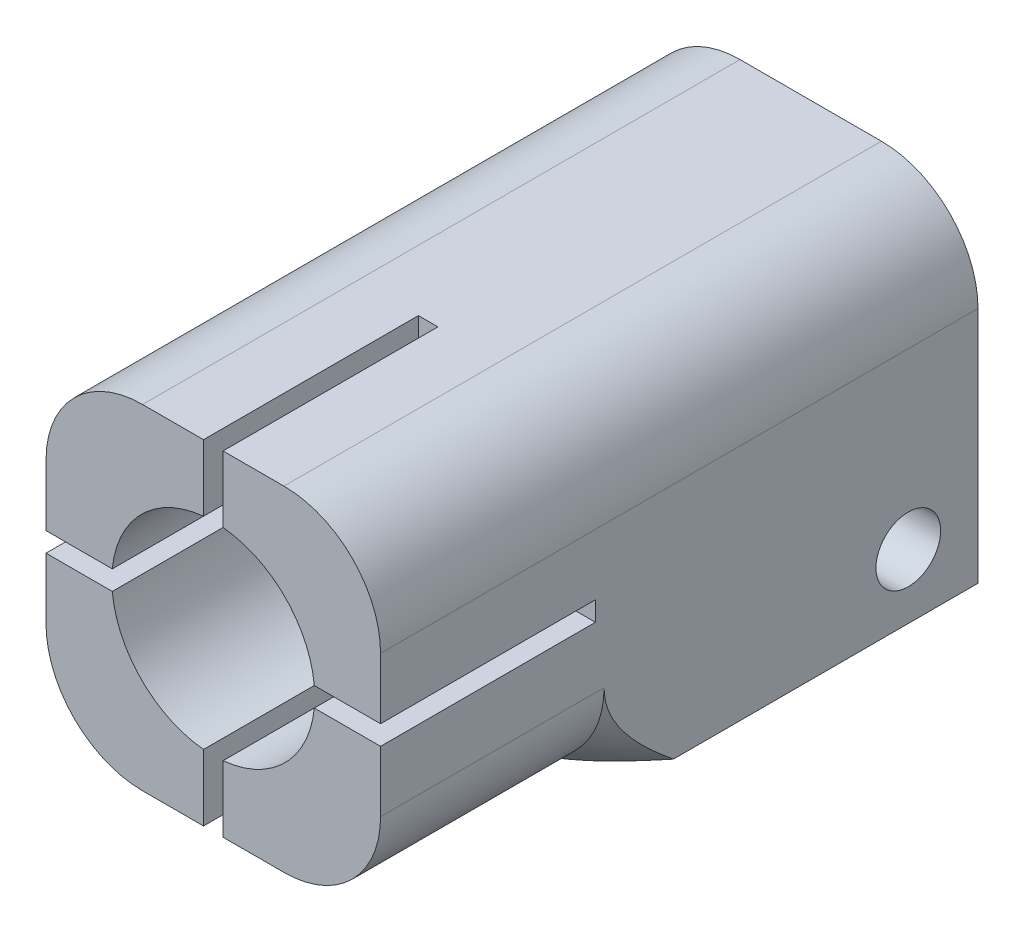
from build123d import *

# Parameters (mm, degrees)
BOSS_EXTRUDE1_DEPTH = 15
SKETCH2_R           = 5.095
CUT_EXTRUDE1_DEPTH  = 10.79
BOSS_EXTRUDE3_START = 15
BOSS_EXTRUDE3_DEPTH = 15
CUT_EXTRUDE2_REACH  = 26.037
SKETCH7_R           = 1.625
CHAMFER2_SIZE       = 2.18
CHAMFER2_SIZE_2     = 3.775870761


with BuildPart() as part:
    # Sketch1 → Boss-Extrude1 (new body)
    with BuildSketch(Plane.XY):
        with BuildLine():
            Line((-3.55, 8.4), (3.55, 8.4))
            ThreePointArc((3.55, 8.4), (6.979467889, 6.979467889), (8.4, 3.55))
            Line((8.4, 3.55), (8.4, -3.55))
            ThreePointArc((8.4, -3.55), (6.979467889, -6.979467889), (3.55, -8.4))
            Line((3.55, -8.4), (-3.55, -8.4))
            ThreePointArc((-3.55, -8.4), (-6.979467889, -6.979467889), (-8.4, -3.55))
            Line((-8.4, -3.55), (-8.4, 3.55))
            ThreePointArc((-8.4, 3.55), (-6.979467889, 6.979467889), (-3.55, 8.4))
        make_face()
    extrude(amount=BOSS_EXTRUDE1_DEPTH)

    # Sketch2 → Cut-Extrude1 (cut)
    with BuildSketch(Plane.XY.offset(15)):
        Circle(SKETCH2_R)
        with BuildLine():
            Line((0.49, 5.071382947), (0.49, 8.4))
            Line((0.49, 8.4), (-0.49, 8.4))
            Line((-0.49, 8.4), (-0.49, 5.071382947))
            ThreePointArc((-0.49, 5.071382947), (0, 5.095), (0.49, 5.071382947))
        make_face()
        with BuildLine():
            Line((5.071382947, -0.49), (8.4, -0.49))
            Line((8.4, -0.49), (8.4, 0.49))
            Line((8.4, 0.49), (5.071382947, 0.49))
            ThreePointArc((5.071382947, 0.49), (5.095, 0), (5.071382947, -0.49))
        make_face()
        with BuildLine():
            Line((-0.49, -5.071382947), (-0.49, -8.4))
            Line((-0.49, -8.4), (0.49, -8.4))
            Line((0.49, -8.4), (0.49, -5.071382947))
            ThreePointArc((0.49, -5.071382947), (0, -5.095), (-0.49, -5.071382947))
        make_face()
        with BuildLine():
            Line((-5.071382947, 0.49), (-8.4, 0.49))
            Line((-8.4, 0.49), (-8.4, -0.49))
            Line((-8.4, -0.49), (-5.071382947, -0.49))
            ThreePointArc((-5.071382947, -0.49), (-5.095, 0), (-5.071382947, 0.49))
        make_face()
    extrude(amount=-CUT_EXTRUDE1_DEPTH, mode=Mode.SUBTRACT)

    # Sketch4 → Boss-Extrude3 (add)
    with BuildSketch(Plane(origin=(0, 0, 0), x_dir=(-1, 0, 0), z_dir=(0, 0, -1)).offset(BOSS_EXTRUDE3_START)):
        with BuildLine():
            Line((-8.4, 3.55), (-8.4, -8.4))
            Line((-8.4, -8.4), (-4, -8.4))
            Line((-4, -8.4), (-4, 4.9))
            Line((-4, 4.9), (4, 4.9))
            Line((4, 4.9), (4, -8.4))
            Line((4, -8.4), (8.4, -8.4))
            Line((8.4, -8.4), (8.4, 3.55))
            ThreePointArc((8.4, 3.55), (6.979467889, 6.979467889), (3.55, 8.4))
            Line((3.55, 8.4), (-3.55, 8.4))
            ThreePointArc((-3.55, 8.4), (-6.979467889, 6.979467889), (-8.4, 3.55))
        make_face()
    extrude(amount=-BOSS_EXTRUDE3_DEPTH)

    # Cut-Extrude2: up to this face of the body (flat: up to its plane)
    cut_extrude2_end = Plane(part.part.faces().sort_by_distance((-8.4, -1.579649264, -2.351915361))[0])
    # Sketch7 → Cut-Extrude2 (cut, up to the picked face)
    with BuildSketch(Plane(origin=(8.4, 0, 0), x_dir=(0, 0, -1), z_dir=(1, 0, 0)), mode=Mode.PRIVATE) as cut_extrude2_sk1:
        with Locations((11.5, -5.175)):
            Circle(SKETCH7_R)
    cut_extrude2_tool1 = split(extrude(cut_extrude2_sk1.sketch, amount=-CUT_EXTRUDE2_REACH, mode=Mode.PRIVATE), bisect_by=cut_extrude2_end, keep=Keep.BOTH, mode=Mode.PRIVATE)
    add(cut_extrude2_tool1.solids().sort_by(Axis((8.4, -5.175, -11.5), (-1, 0, 0)))[0], mode=Mode.SUBTRACT)

    # Chamfer2
    # the kernel refuses this chamfer: 3.775870761, 2.18 mm, written as the material it adds along each edge
    with BuildSketch(Plane(origin=(-3.55, -3.55, 0), x_dir=(0.9389857690160399, 0.343955993675581, 0), z_dir=(-0.343955993675581, 0.9389857690160399, 0))) as chamfer2_piece_1_section:
        Polygon((4.85 + CHAMFER2_SIZE, 0), (4.85, -CHAMFER2_SIZE_2), (4.85, 0), align=None)
    chamfer2_piece_1 = revolve(axis=Axis((-3.55, -3.55, 0), (0, 0, -1)), revolution_arc=315.559918018, mode=Mode.PRIVATE)
    chamfer2_piece_1 = split(chamfer2_piece_1, bisect_by=Plane(origin=(-4, -7.19796441, 1.47894359), z_dir=(-1, 0, 0)), keep=Keep.TOP, mode=Mode.PRIVATE)
    chamfer2_piece_1 = split(chamfer2_piece_1, bisect_by=Plane(origin=(-7.201843372, -8.4, 1.47894359), z_dir=(0, 1, 0)), keep=Keep.TOP, mode=Mode.PRIVATE)
    chamfer2_piece_1 = split(chamfer2_piece_1, bisect_by=Plane(origin=(-8.4, -7.19796441, 1.47894359), z_dir=(1, 0, 0)), keep=Keep.TOP, mode=Mode.PRIVATE)
    add(chamfer2_piece_1)
    with BuildSketch(Plane(origin=(3.55, -3.55, 0), x_dir=(-0.42959466391895607, 0.9030218295990186, 0), z_dir=(-0.9030218295990186, -0.42959466391895607, 0))) as chamfer2_piece_2_section:
        Polygon((4.85, -CHAMFER2_SIZE_2), (4.85 + CHAMFER2_SIZE, 0), (4.85, 0), align=None)
    chamfer2_piece_2 = revolve(axis=Axis((3.55, -3.55, 0), (0, 0, -1)), revolution_arc=315.559918018, mode=Mode.PRIVATE)
    chamfer2_piece_2 = split(chamfer2_piece_2, bisect_by=Plane(origin=(8.4, -7.197964411, 1.478943589), z_dir=(-1, 0, 0)), keep=Keep.TOP, mode=Mode.PRIVATE)
    chamfer2_piece_2 = split(chamfer2_piece_2, bisect_by=Plane(origin=(7.201843372, -8.4, 1.478943589), z_dir=(0, 1, 0)), keep=Keep.TOP, mode=Mode.PRIVATE)
    chamfer2_piece_2 = split(chamfer2_piece_2, bisect_by=Plane(origin=(4, -7.197964411, 1.478943589), z_dir=(1, 0, 0)), keep=Keep.TOP, mode=Mode.PRIVATE)
    add(chamfer2_piece_2)


solid = part.part
